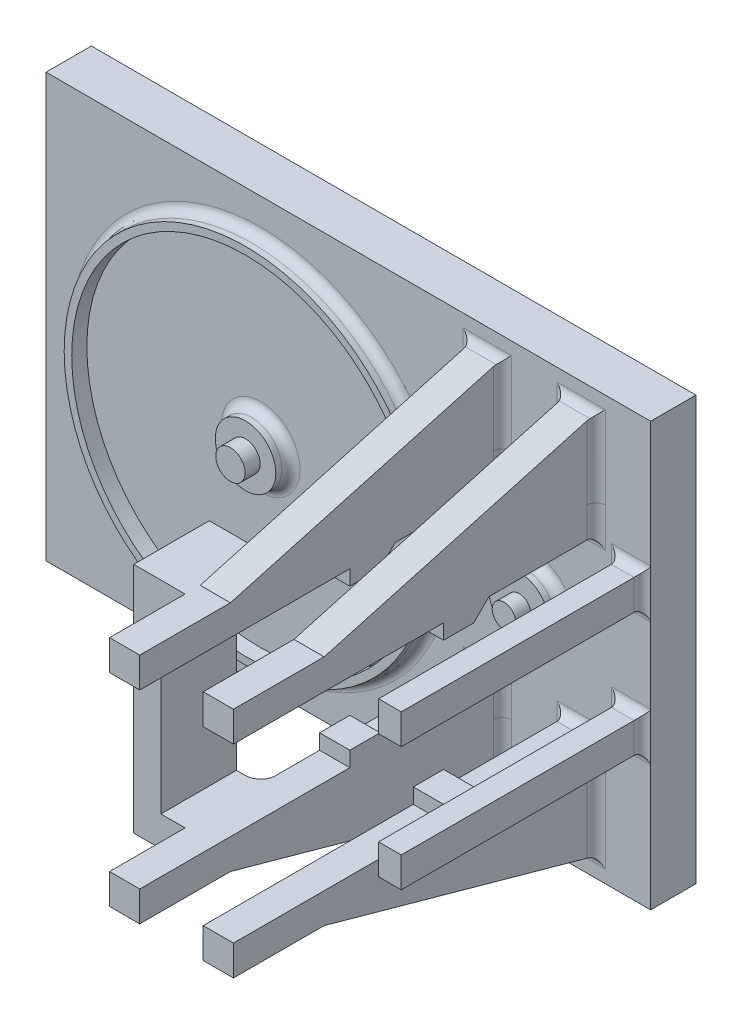
from build123d import *

# Parameters (mm, degrees)
SKETCH3_W            = 200
SKETCH3_H            = 140
BOSS_EXTRUDE1_DEPTH  = 15
SKETCH4_W            = 5
SKETCH4_H            = 10
SKETCH4_W_2          = 10
SKETCH4_H_2          = 5
BOSS_EXTRUDE5_DEPTH  = 70
SKETCH8_W            = 10
SKETCH8_H            = 10
BOSS_EXTRUDE6_DEPTH  = 5
CUT_EXTRUDE2_REACH   = 212.668
SKETCH10_W           = 10
SKETCH10_H           = 10
BOSS_EXTRUDE7_DEPTH  = 5
CUT_EXTRUDE3_REACH   = 212.668
SKETCH12_R           = 10
BOSS_EXTRUDE8_DEPTH  = 5
SKETCH13_R           = 4.85
SKETCH13_R_2         = 3.85
BOSS_EXTRUDE9_DEPTH  = 5
SKETCH14_W           = 5
SKETCH14_H           = 10
CUT_EXTRUDE4_DEPTH   = 20
SKETCH16_W           = 10
SKETCH16_H           = 5
SKETCH16_W_2         = 2.5
SKETCH16_H_2         = 10
BOSS_EXTRUDE11_DEPTH = 70
SKETCH17_W           = 5
SKETCH17_H           = 10
BOSS_EXTRUDE12_DEPTH = 20
FILLET1_R            = 3
SKETCH18_W           = 10
SKETCH18_H           = 10
BOSS_EXTRUDE13_DEPTH = 50
SKETCH19_W           = 10
SKETCH19_H           = 5
BOSS_EXTRUDE14_DEPTH = 5
FILLET3_R            = 3
SKETCH20_W           = 7.5
SKETCH20_H           = 10
SKETCH20_H_2         = 10.000293456
BOSS_EXTRUDE16_DEPTH = 10
BOSS_EXTRUDE17_REACH = 261.083
SKETCH22_W           = 21
SKETCH22_H           = 90
CUT_EXTRUDE6_DEPTH   = 258.239674312
SKETCH23_W           = 21
SKETCH23_H           = 90
CUT_EXTRUDE7_DEPTH   = 258.239674312
FILLET4_R            = 3
BOSS_EXTRUDE19_DEPTH = 50
CUT_EXTRUDE9_DEPTH   = 25
FILLET5_R            = 5
SKETCH28_R           = 13
CUT_EXTRUDE10_DEPTH  = 10
SKETCH29_R           = 10
BOSS_EXTRUDE21_DEPTH = 5
SKETCH30_R           = 3.9
BOSS_EXTRUDE22_DEPTH = 5
FILLET6_R            = 3
SKETCH15_R           = 60
SKETCH15_R_2         = 57.5
BOSS_EXTRUDE23_DEPTH = 5
FILLET7_R            = 3


with BuildPart() as part:
    # Sketch3 → Boss-Extrude1 (new body)
    with BuildSketch(Plane.XY):
        with Locations((100, 70)):
            Rectangle(SKETCH3_W, SKETCH3_H)
    extrude(amount=-BOSS_EXTRUDE1_DEPTH)

    # Sketch4 → Boss-Extrude5 (add)
    with BuildSketch(Plane.XY):
        with Locations((192.5, 49.5)):
            Rectangle(SKETCH4_W, SKETCH4_H)
        with Locations((192.5, 90.5)):
            Rectangle(SKETCH4_W, SKETCH4_H)
        with Locations((177, 101)):
            Rectangle(SKETCH4_W_2, SKETCH4_H_2)
        with Locations((146, 101)):
            Rectangle(SKETCH4_W_2, SKETCH4_H_2)
        with Locations((146, 39)):
            Rectangle(SKETCH4_W_2, SKETCH4_H_2)
        with Locations((177, 39)):
            Rectangle(SKETCH4_W_2, SKETCH4_H_2)
    extrude(amount=BOSS_EXTRUDE5_DEPTH)

    # Sketch8 → Boss-Extrude6 (add)
    with BuildSketch(Plane.XZ.offset(-98.5)):
        with Locations((146, 40.5)):
            Rectangle(SKETCH8_W, SKETCH8_H)
        with Locations((177, 40.5)):
            Rectangle(SKETCH8_W, SKETCH8_H)
    extrude(amount=BOSS_EXTRUDE6_DEPTH)

    # Cut-Extrude2: up to this face of the body (flat: up to its plane)
    cut_extrude2_end = Plane(part.part.faces().sort_by_distance((182, 100.375, 35.6875))[0])
    # Sketch9 → Cut-Extrude2 (cut, up to the picked face)
    with BuildSketch(Plane.ZY.offset(-141), mode=Mode.PRIVATE) as cut_extrude2_sk1:
        Polygon((40.5, 93.5), (35.5, 93.5), (35.5, 98.5), align=None)
    cut_extrude2_tool1 = split(extrude(cut_extrude2_sk1.sketch, amount=-CUT_EXTRUDE2_REACH, mode=Mode.PRIVATE), bisect_by=cut_extrude2_end, keep=Keep.BOTH, mode=Mode.PRIVATE)
    add(cut_extrude2_tool1.solids().sort_by(Axis((141, 95.166667, 37.166667), (1, 0, 0)))[0], mode=Mode.SUBTRACT)

    # Sketch10 → Boss-Extrude7 (add)
    with BuildSketch(Plane(origin=(0, 41.5, 0), x_dir=(1, 0, 0), z_dir=(0, 1, 0))):
        with Locations((146, -40.5)):
            Rectangle(SKETCH10_W, SKETCH10_H)
        with Locations((177, -40.5)):
            Rectangle(SKETCH10_W, SKETCH10_H)
    extrude(amount=BOSS_EXTRUDE7_DEPTH)

    # Cut-Extrude3: up to this face of the body (flat: up to its plane)
    cut_extrude3_end = Plane(part.part.faces().sort_by_distance((182, 39.625, 35.6875))[0])
    # Sketch11 → Cut-Extrude3 (cut, up to the picked face)
    with BuildSketch(Plane.ZY.offset(-141), mode=Mode.PRIVATE) as cut_extrude3_sk1:
        Polygon((35.5, 41.5), (40.5, 46.5), (35.5, 46.5), align=None)
    cut_extrude3_tool1 = split(extrude(cut_extrude3_sk1.sketch, amount=-CUT_EXTRUDE3_REACH, mode=Mode.PRIVATE), bisect_by=cut_extrude3_end, keep=Keep.BOTH, mode=Mode.PRIVATE)
    add(cut_extrude3_tool1.solids().sort_by(Axis((141, 44.833333, 37.166667), (1, 0, 0)))[0], mode=Mode.SUBTRACT)

    # Sketch12 → Boss-Extrude8 (add)
    with BuildSketch(Plane.XY):
        with Locations(Location((161.5, 68.111226305, 0), (0, 0, 180))):
            Circle(SKETCH12_R)
        with Locations(Location((71, 68.111226305, 0), (0, 0, 180))):
            Circle(SKETCH12_R)
    extrude(amount=BOSS_EXTRUDE8_DEPTH)

    # Sketch13 → Boss-Extrude9 (add)
    with BuildSketch(Plane.XY.offset(5)):
        with Locations((71, 68.111226305)):
            Circle(SKETCH13_R)
        with Locations((161.5, 68.111226305)):
            Circle(SKETCH13_R_2)
    extrude(amount=BOSS_EXTRUDE9_DEPTH)

    # Sketch14 → Cut-Extrude4 (cut)
    with BuildSketch(Plane.XY.offset(70)):
        with Locations((192.5, 90.5)):
            Rectangle(SKETCH14_W, SKETCH14_H)
        with Locations((192.5, 49.5)):
            Rectangle(SKETCH14_W, SKETCH14_H)
    extrude(amount=-CUT_EXTRUDE4_DEPTH, mode=Mode.SUBTRACT)

    # Sketch16 → Boss-Extrude11 (add)
    with BuildSketch(Plane.XY):
        with Locations((146, 106)):
            Rectangle(SKETCH16_W, SKETCH16_H)
        with Locations((177, 106)):
            Rectangle(SKETCH16_W, SKETCH16_H)
        with Locations((196.25, 90.5)):
            Rectangle(SKETCH16_W_2, SKETCH16_H_2)
        with Locations((146, 34)):
            Rectangle(SKETCH16_W, SKETCH16_H)
        with Locations((177, 34)):
            Rectangle(SKETCH16_W, SKETCH16_H)
        with Locations((196.25, 49.5)):
            Rectangle(SKETCH16_W_2, SKETCH16_H_2)
    extrude(amount=BOSS_EXTRUDE11_DEPTH)

    # Sketch17 → Boss-Extrude12 (add)
    with BuildSketch(Plane.XY.offset(50)):
        with Locations((192.5, 90.5)):
            Rectangle(SKETCH17_W, SKETCH17_H)
        with Locations((192.5, 49.5)):
            Rectangle(SKETCH17_W, SKETCH17_H)
    extrude(amount=BOSS_EXTRUDE12_DEPTH)

    # Fillet1
    # the kernel refuses this fillet: 3 mm, written as the material it adds along each edge
    with BuildSketch(Plane(origin=(190, 54.5, 0), x_dir=(-1, 0, 0), z_dir=(0, -1, 0)), Plane(origin=(190, 95.5, 0), x_dir=(-1, 0, 0), z_dir=(0, -1, 0)), Plane(origin=(172, 98.5, 0), x_dir=(0, -1, 0), z_dir=(1, 0, 0)), Plane(origin=(141, 98.5, 0), x_dir=(0, -1, 0), z_dir=(1, 0, 0)), Plane(origin=(182, 41.5, 0), x_dir=(0, 1, 0), z_dir=(-1, 0, 0)), Plane(origin=(151, 41.5, 0), x_dir=(0, 1, 0), z_dir=(-1, 0, 0))) as fillet1_piece_1:
        with BuildLine():
            CenterArc((FILLET1_R, -FILLET1_R), FILLET1_R, 90, 90)
            Line((0, -FILLET1_R), (-FILLET1_R * 0.02, -FILLET1_R))
            Line((-FILLET1_R * 0.02, -FILLET1_R), (-FILLET1_R * 0.02, FILLET1_R * 0.02))
            Line((-FILLET1_R * 0.02, FILLET1_R * 0.02), (FILLET1_R, FILLET1_R * 0.02))
            Line((FILLET1_R, FILLET1_R * 0.02), (FILLET1_R, 0))
        make_face()
    extrude(amount=10)
    with BuildSketch(Plane(origin=(141, 98.5, 0), x_dir=(-1, 0, 0), z_dir=(0, 1, 0)), Plane(origin=(151, 108.5, 0), x_dir=(1, 0, 0), z_dir=(0, -1, 0)), Plane(origin=(172, 98.5, 0), x_dir=(-1, 0, 0), z_dir=(0, 1, 0)), Plane(origin=(182, 108.5, 0), x_dir=(1, 0, 0), z_dir=(0, -1, 0)), Plane(origin=(182, 41.5, 0), x_dir=(1, 0, 0), z_dir=(0, -1, 0)), Plane(origin=(172, 31.5, 0), x_dir=(-1, 0, 0), z_dir=(0, 1, 0)), Plane(origin=(151, 41.5, 0), x_dir=(1, 0, 0), z_dir=(0, -1, 0)), Plane(origin=(141, 31.5, 0), x_dir=(-1, 0, 0), z_dir=(0, 1, 0))) as fillet1_piece_2:
        with BuildLine():
            CenterArc((FILLET1_R, FILLET1_R), FILLET1_R, 180, 90)
            Line((0, FILLET1_R), (-FILLET1_R * 0.02, FILLET1_R))
            Line((-FILLET1_R * 0.02, FILLET1_R), (-FILLET1_R * 0.02, -FILLET1_R * 0.02))
            Line((-FILLET1_R * 0.02, -FILLET1_R * 0.02), (FILLET1_R, -FILLET1_R * 0.02))
            Line((FILLET1_R, -FILLET1_R * 0.02), (FILLET1_R, 0))
        make_face()
    extrude(amount=10)
    with BuildSketch(Plane(origin=(190, 95.5, 0), x_dir=(0, 1, 0), z_dir=(1, 0, 0)), Plane(origin=(197.5, 85.5, 0), x_dir=(0, -1, 0), z_dir=(-1, 0, 0)), Plane(origin=(190, 54.5, 0), x_dir=(0, 1, 0), z_dir=(1, 0, 0)), Plane(origin=(197.5, 44.5, 0), x_dir=(0, -1, 0), z_dir=(-1, 0, 0))) as fillet1_piece_3:
        with BuildLine():
            CenterArc((FILLET1_R, FILLET1_R), FILLET1_R, 180, 90)
            Line((0, FILLET1_R), (-FILLET1_R * 0.02, FILLET1_R))
            Line((-FILLET1_R * 0.02, FILLET1_R), (-FILLET1_R * 0.02, -FILLET1_R * 0.02))
            Line((-FILLET1_R * 0.02, -FILLET1_R * 0.02), (FILLET1_R, -FILLET1_R * 0.02))
            Line((FILLET1_R, -FILLET1_R * 0.02), (FILLET1_R, 0))
        make_face()
    extrude(amount=7.5)
    with BuildSketch(Plane(origin=(197.5, 95.5, 0), x_dir=(1, 0, 0), z_dir=(0, -1, 0)), Plane(origin=(197.5, 54.5, 0), x_dir=(1, 0, 0), z_dir=(0, -1, 0))) as fillet1_piece_4:
        with BuildLine():
            CenterArc((3, 2.958039892), FILLET1_R, 180, 80.405931773)
            Line((0, 2.958039892), (-0.06, 2.958039892))
            Line((-0.06, 2.958039892), (-0.06, 0))
            Line((-0.06, 0), (0, -0.06))
            ThreePointArc((0, -0.06), (1.25, -0.06), (2.49, -0.059160798))
            Line((2.49, -0.059160798), (2.5, 0))
        make_face()
    extrude(amount=10)
    with BuildSketch(Plane(origin=(182.5, 54.5, 0), x_dir=(0, 1, 0), z_dir=(1, 0, 0))) as fillet1_piece_5a_section:
        with BuildLine():
            CenterArc((FILLET1_R, FILLET1_R), FILLET1_R, 180, 90)
            Line((0, FILLET1_R), (-FILLET1_R * 0.02, FILLET1_R))
            Line((-FILLET1_R * 0.02, FILLET1_R), (-FILLET1_R * 0.02, -FILLET1_R * 0.02))
            Line((-FILLET1_R * 0.02, -FILLET1_R * 0.02), (FILLET1_R, -FILLET1_R * 0.02))
            Line((FILLET1_R, -FILLET1_R * 0.02), (FILLET1_R, 0))
        make_face()
    fillet1_piece_5a = extrude(amount=15, mode=Mode.PRIVATE)
    fillet1_piece_5a = split(fillet1_piece_5a, bisect_by=Plane(origin=(190, 55.179185343, 0.679185343), z_dir=(-1, 0, 0)), keep=Keep.TOP, mode=Mode.PRIVATE)
    with BuildSketch(Plane(origin=(190, 62, 0), x_dir=(-1, 0, 0), z_dir=(0, -1, 0))) as fillet1_piece_5b_section:
        with BuildLine():
            CenterArc((FILLET1_R, -FILLET1_R), FILLET1_R, 90, 90)
            Line((0, -FILLET1_R), (-FILLET1_R * 0.02, -FILLET1_R))
            Line((-FILLET1_R * 0.02, -FILLET1_R), (-FILLET1_R * 0.02, FILLET1_R * 0.02))
            Line((-FILLET1_R * 0.02, FILLET1_R * 0.02), (FILLET1_R, FILLET1_R * 0.02))
            Line((FILLET1_R, FILLET1_R * 0.02), (FILLET1_R, 0))
        make_face()
    fillet1_piece_5b = extrude(amount=17.5, mode=Mode.PRIVATE)
    fillet1_piece_5b = split(fillet1_piece_5b, bisect_by=Plane(origin=(189.320814657, 54.5, 0.679185343), z_dir=(0, 1, 0)), keep=Keep.TOP, mode=Mode.PRIVATE)
    fillet1_piece_5 = fillet1_piece_5a & fillet1_piece_5b
    add(fillet1_piece_5)
    with BuildSketch(Plane(origin=(197.5, 44.5, 0), x_dir=(0, -1, 0), z_dir=(-1, 0, 0))) as fillet1_piece_6a_section:
        with BuildLine():
            CenterArc((FILLET1_R, FILLET1_R), FILLET1_R, 180, 90)
            Line((0, FILLET1_R), (-FILLET1_R * 0.02, FILLET1_R))
            Line((-FILLET1_R * 0.02, FILLET1_R), (-FILLET1_R * 0.02, -FILLET1_R * 0.02))
            Line((-FILLET1_R * 0.02, -FILLET1_R * 0.02), (FILLET1_R, -FILLET1_R * 0.02))
            Line((FILLET1_R, -FILLET1_R * 0.02), (FILLET1_R, 0))
        make_face()
    fillet1_piece_6a = extrude(amount=15, mode=Mode.PRIVATE)
    fillet1_piece_6a = split(fillet1_piece_6a, bisect_by=Plane(origin=(190, 43.820814657, 0.679185343), z_dir=(-1, 0, 0)), keep=Keep.TOP, mode=Mode.PRIVATE)
    with BuildSketch(Plane(origin=(190, 54.5, 0), x_dir=(-1, 0, 0), z_dir=(0, -1, 0))) as fillet1_piece_6b_section:
        with BuildLine():
            CenterArc((FILLET1_R, -FILLET1_R), FILLET1_R, 90, 90)
            Line((0, -FILLET1_R), (-FILLET1_R * 0.02, -FILLET1_R))
            Line((-FILLET1_R * 0.02, -FILLET1_R), (-FILLET1_R * 0.02, FILLET1_R * 0.02))
            Line((-FILLET1_R * 0.02, FILLET1_R * 0.02), (FILLET1_R, FILLET1_R * 0.02))
            Line((FILLET1_R, FILLET1_R * 0.02), (FILLET1_R, 0))
        make_face()
    fillet1_piece_6b = extrude(amount=17.5, mode=Mode.PRIVATE)
    fillet1_piece_6b = split(fillet1_piece_6b, bisect_by=Plane(origin=(189.320814657, 44.5, 0.679185343), z_dir=(0, -1, 0)), keep=Keep.TOP, mode=Mode.PRIVATE)
    fillet1_piece_6 = fillet1_piece_6a & fillet1_piece_6b
    add(fillet1_piece_6)
    with BuildSketch(Plane(origin=(190, 103, 0), x_dir=(-1, 0, 0), z_dir=(0, -1, 0))) as fillet1_piece_7a_section:
        with BuildLine():
            CenterArc((FILLET1_R, -FILLET1_R), FILLET1_R, 90, 90)
            Line((0, -FILLET1_R), (-FILLET1_R * 0.02, -FILLET1_R))
            Line((-FILLET1_R * 0.02, -FILLET1_R), (-FILLET1_R * 0.02, FILLET1_R * 0.02))
            Line((-FILLET1_R * 0.02, FILLET1_R * 0.02), (FILLET1_R, FILLET1_R * 0.02))
            Line((FILLET1_R, FILLET1_R * 0.02), (FILLET1_R, 0))
        make_face()
    fillet1_piece_7a = extrude(amount=17.5, mode=Mode.PRIVATE)
    fillet1_piece_7a = split(fillet1_piece_7a, bisect_by=Plane(origin=(189.320814657, 95.5, 0.679185343), z_dir=(0, 1, 0)), keep=Keep.TOP, mode=Mode.PRIVATE)
    with BuildSketch(Plane(origin=(182.5, 95.5, 0), x_dir=(0, 1, 0), z_dir=(1, 0, 0))) as fillet1_piece_7b_section:
        with BuildLine():
            CenterArc((FILLET1_R, FILLET1_R), FILLET1_R, 180, 90)
            Line((0, FILLET1_R), (-FILLET1_R * 0.02, FILLET1_R))
            Line((-FILLET1_R * 0.02, FILLET1_R), (-FILLET1_R * 0.02, -FILLET1_R * 0.02))
            Line((-FILLET1_R * 0.02, -FILLET1_R * 0.02), (FILLET1_R, -FILLET1_R * 0.02))
            Line((FILLET1_R, -FILLET1_R * 0.02), (FILLET1_R, 0))
        make_face()
    fillet1_piece_7b = extrude(amount=15, mode=Mode.PRIVATE)
    fillet1_piece_7b = split(fillet1_piece_7b, bisect_by=Plane(origin=(190, 96.179185343, 0.679185343), z_dir=(-1, 0, 0)), keep=Keep.TOP, mode=Mode.PRIVATE)
    fillet1_piece_7 = fillet1_piece_7a & fillet1_piece_7b
    add(fillet1_piece_7)
    with BuildSketch(Plane(origin=(197.5, 85.5, 0), x_dir=(0, -1, 0), z_dir=(-1, 0, 0))) as fillet1_piece_8a_section:
        with BuildLine():
            CenterArc((FILLET1_R, FILLET1_R), FILLET1_R, 180, 90)
            Line((0, FILLET1_R), (-FILLET1_R * 0.02, FILLET1_R))
            Line((-FILLET1_R * 0.02, FILLET1_R), (-FILLET1_R * 0.02, -FILLET1_R * 0.02))
            Line((-FILLET1_R * 0.02, -FILLET1_R * 0.02), (FILLET1_R, -FILLET1_R * 0.02))
            Line((FILLET1_R, -FILLET1_R * 0.02), (FILLET1_R, 0))
        make_face()
    fillet1_piece_8a = extrude(amount=15, mode=Mode.PRIVATE)
    fillet1_piece_8a = split(fillet1_piece_8a, bisect_by=Plane(origin=(190, 84.820814657, 0.679185343), z_dir=(-1, 0, 0)), keep=Keep.TOP, mode=Mode.PRIVATE)
    with BuildSketch(Plane(origin=(190, 95.5, 0), x_dir=(-1, 0, 0), z_dir=(0, -1, 0))) as fillet1_piece_8b_section:
        with BuildLine():
            CenterArc((FILLET1_R, -FILLET1_R), FILLET1_R, 90, 90)
            Line((0, -FILLET1_R), (-FILLET1_R * 0.02, -FILLET1_R))
            Line((-FILLET1_R * 0.02, -FILLET1_R), (-FILLET1_R * 0.02, FILLET1_R * 0.02))
            Line((-FILLET1_R * 0.02, FILLET1_R * 0.02), (FILLET1_R, FILLET1_R * 0.02))
            Line((FILLET1_R, FILLET1_R * 0.02), (FILLET1_R, 0))
        make_face()
    fillet1_piece_8b = extrude(amount=17.5, mode=Mode.PRIVATE)
    fillet1_piece_8b = split(fillet1_piece_8b, bisect_by=Plane(origin=(189.320814657, 85.5, 0.679185343), z_dir=(0, -1, 0)), keep=Keep.TOP, mode=Mode.PRIVATE)
    fillet1_piece_8 = fillet1_piece_8a & fillet1_piece_8b
    add(fillet1_piece_8)
    with BuildSketch(Plane(origin=(164.5, 98.5, 0), x_dir=(0, -1, 0), z_dir=(1, 0, 0))) as fillet1_piece_9a_section:
        with BuildLine():
            CenterArc((FILLET1_R, -FILLET1_R), FILLET1_R, 90, 90)
            Line((0, -FILLET1_R), (-FILLET1_R * 0.02, -FILLET1_R))
            Line((-FILLET1_R * 0.02, -FILLET1_R), (-FILLET1_R * 0.02, FILLET1_R * 0.02))
            Line((-FILLET1_R * 0.02, FILLET1_R * 0.02), (FILLET1_R, FILLET1_R * 0.02))
            Line((FILLET1_R, FILLET1_R * 0.02), (FILLET1_R, 0))
        make_face()
    fillet1_piece_9a = extrude(amount=17.5, mode=Mode.PRIVATE)
    fillet1_piece_9a = split(fillet1_piece_9a, bisect_by=Plane(origin=(172, 97.820814657, 0.679185343), z_dir=(-1, 0, 0)), keep=Keep.TOP, mode=Mode.PRIVATE)
    with BuildSketch(Plane(origin=(172, 91, 0), x_dir=(-1, 0, 0), z_dir=(0, 1, 0))) as fillet1_piece_9b_section:
        with BuildLine():
            CenterArc((FILLET1_R, FILLET1_R), FILLET1_R, 180, 90)
            Line((0, FILLET1_R), (-FILLET1_R * 0.02, FILLET1_R))
            Line((-FILLET1_R * 0.02, FILLET1_R), (-FILLET1_R * 0.02, -FILLET1_R * 0.02))
            Line((-FILLET1_R * 0.02, -FILLET1_R * 0.02), (FILLET1_R, -FILLET1_R * 0.02))
            Line((FILLET1_R, -FILLET1_R * 0.02), (FILLET1_R, 0))
        make_face()
    fillet1_piece_9b = extrude(amount=17.5, mode=Mode.PRIVATE)
    fillet1_piece_9b = split(fillet1_piece_9b, bisect_by=Plane(origin=(171.320814657, 98.5, 0.679185343), z_dir=(0, -1, 0)), keep=Keep.TOP, mode=Mode.PRIVATE)
    fillet1_piece_9 = fillet1_piece_9a & fillet1_piece_9b
    add(fillet1_piece_9)
    with BuildSketch(Plane(origin=(172, 98.5, 0), x_dir=(0, -1, 0), z_dir=(1, 0, 0))) as fillet1_piece_10a_section:
        with BuildLine():
            CenterArc((FILLET1_R, -FILLET1_R), FILLET1_R, 90, 90)
            Line((0, -FILLET1_R), (-FILLET1_R * 0.02, -FILLET1_R))
            Line((-FILLET1_R * 0.02, -FILLET1_R), (-FILLET1_R * 0.02, FILLET1_R * 0.02))
            Line((-FILLET1_R * 0.02, FILLET1_R * 0.02), (FILLET1_R, FILLET1_R * 0.02))
            Line((FILLET1_R, FILLET1_R * 0.02), (FILLET1_R, 0))
        make_face()
    fillet1_piece_10a = extrude(amount=17.5, mode=Mode.PRIVATE)
    fillet1_piece_10a = split(fillet1_piece_10a, bisect_by=Plane(origin=(182, 97.820814657, 0.679185343), z_dir=(1, 0, 0)), keep=Keep.TOP, mode=Mode.PRIVATE)
    with BuildSketch(Plane(origin=(182, 108.5, 0), x_dir=(1, 0, 0), z_dir=(0, -1, 0))) as fillet1_piece_10b_section:
        with BuildLine():
            CenterArc((FILLET1_R, FILLET1_R), FILLET1_R, 180, 90)
            Line((0, FILLET1_R), (-FILLET1_R * 0.02, FILLET1_R))
            Line((-FILLET1_R * 0.02, FILLET1_R), (-FILLET1_R * 0.02, -FILLET1_R * 0.02))
            Line((-FILLET1_R * 0.02, -FILLET1_R * 0.02), (FILLET1_R, -FILLET1_R * 0.02))
            Line((FILLET1_R, -FILLET1_R * 0.02), (FILLET1_R, 0))
        make_face()
    fillet1_piece_10b = extrude(amount=17.5, mode=Mode.PRIVATE)
    fillet1_piece_10b = split(fillet1_piece_10b, bisect_by=Plane(origin=(182.679185343, 98.5, 0.679185343), z_dir=(0, -1, 0)), keep=Keep.TOP, mode=Mode.PRIVATE)
    fillet1_piece_10 = fillet1_piece_10a & fillet1_piece_10b
    add(fillet1_piece_10)
    with BuildSketch(Plane(origin=(133.5, 98.5, 0), x_dir=(0, -1, 0), z_dir=(1, 0, 0))) as fillet1_piece_11a_section:
        with BuildLine():
            CenterArc((FILLET1_R, -FILLET1_R), FILLET1_R, 90, 90)
            Line((0, -FILLET1_R), (-FILLET1_R * 0.02, -FILLET1_R))
            Line((-FILLET1_R * 0.02, -FILLET1_R), (-FILLET1_R * 0.02, FILLET1_R * 0.02))
            Line((-FILLET1_R * 0.02, FILLET1_R * 0.02), (FILLET1_R, FILLET1_R * 0.02))
            Line((FILLET1_R, FILLET1_R * 0.02), (FILLET1_R, 0))
        make_face()
    fillet1_piece_11a = extrude(amount=17.5, mode=Mode.PRIVATE)
    fillet1_piece_11a = split(fillet1_piece_11a, bisect_by=Plane(origin=(141, 97.820814657, 0.679185343), z_dir=(-1, 0, 0)), keep=Keep.TOP, mode=Mode.PRIVATE)
    with BuildSketch(Plane(origin=(141, 91, 0), x_dir=(-1, 0, 0), z_dir=(0, 1, 0))) as fillet1_piece_11b_section:
        with BuildLine():
            CenterArc((FILLET1_R, FILLET1_R), FILLET1_R, 180, 90)
            Line((0, FILLET1_R), (-FILLET1_R * 0.02, FILLET1_R))
            Line((-FILLET1_R * 0.02, FILLET1_R), (-FILLET1_R * 0.02, -FILLET1_R * 0.02))
            Line((-FILLET1_R * 0.02, -FILLET1_R * 0.02), (FILLET1_R, -FILLET1_R * 0.02))
            Line((FILLET1_R, -FILLET1_R * 0.02), (FILLET1_R, 0))
        make_face()
    fillet1_piece_11b = extrude(amount=17.5, mode=Mode.PRIVATE)
    fillet1_piece_11b = split(fillet1_piece_11b, bisect_by=Plane(origin=(140.320814657, 98.5, 0.679185343), z_dir=(0, -1, 0)), keep=Keep.TOP, mode=Mode.PRIVATE)
    fillet1_piece_11 = fillet1_piece_11a & fillet1_piece_11b
    add(fillet1_piece_11)
    with BuildSketch(Plane(origin=(141, 98.5, 0), x_dir=(0, -1, 0), z_dir=(1, 0, 0))) as fillet1_piece_12a_section:
        with BuildLine():
            CenterArc((FILLET1_R, -FILLET1_R), FILLET1_R, 90, 90)
            Line((0, -FILLET1_R), (-FILLET1_R * 0.02, -FILLET1_R))
            Line((-FILLET1_R * 0.02, -FILLET1_R), (-FILLET1_R * 0.02, FILLET1_R * 0.02))
            Line((-FILLET1_R * 0.02, FILLET1_R * 0.02), (FILLET1_R, FILLET1_R * 0.02))
            Line((FILLET1_R, FILLET1_R * 0.02), (FILLET1_R, 0))
        make_face()
    fillet1_piece_12a = extrude(amount=17.5, mode=Mode.PRIVATE)
    fillet1_piece_12a = split(fillet1_piece_12a, bisect_by=Plane(origin=(151, 97.820814657, 0.679185343), z_dir=(1, 0, 0)), keep=Keep.TOP, mode=Mode.PRIVATE)
    with BuildSketch(Plane(origin=(151, 108.5, 0), x_dir=(1, 0, 0), z_dir=(0, -1, 0))) as fillet1_piece_12b_section:
        with BuildLine():
            CenterArc((FILLET1_R, FILLET1_R), FILLET1_R, 180, 90)
            Line((0, FILLET1_R), (-FILLET1_R * 0.02, FILLET1_R))
            Line((-FILLET1_R * 0.02, FILLET1_R), (-FILLET1_R * 0.02, -FILLET1_R * 0.02))
            Line((-FILLET1_R * 0.02, -FILLET1_R * 0.02), (FILLET1_R, -FILLET1_R * 0.02))
            Line((FILLET1_R, -FILLET1_R * 0.02), (FILLET1_R, 0))
        make_face()
    fillet1_piece_12b = extrude(amount=17.5, mode=Mode.PRIVATE)
    fillet1_piece_12b = split(fillet1_piece_12b, bisect_by=Plane(origin=(151.679185343, 98.5, 0.679185343), z_dir=(0, -1, 0)), keep=Keep.TOP, mode=Mode.PRIVATE)
    fillet1_piece_12 = fillet1_piece_12a & fillet1_piece_12b
    add(fillet1_piece_12)
    with BuildSketch(Plane(origin=(182, 49, 0), x_dir=(1, 0, 0), z_dir=(0, -1, 0))) as fillet1_piece_13a_section:
        with BuildLine():
            CenterArc((FILLET1_R, FILLET1_R), FILLET1_R, 180, 90)
            Line((0, FILLET1_R), (-FILLET1_R * 0.02, FILLET1_R))
            Line((-FILLET1_R * 0.02, FILLET1_R), (-FILLET1_R * 0.02, -FILLET1_R * 0.02))
            Line((-FILLET1_R * 0.02, -FILLET1_R * 0.02), (FILLET1_R, -FILLET1_R * 0.02))
            Line((FILLET1_R, -FILLET1_R * 0.02), (FILLET1_R, 0))
        make_face()
    fillet1_piece_13a = extrude(amount=17.5, mode=Mode.PRIVATE)
    fillet1_piece_13a = split(fillet1_piece_13a, bisect_by=Plane(origin=(182.679185343, 41.5, 0.679185343), z_dir=(0, 1, 0)), keep=Keep.TOP, mode=Mode.PRIVATE)
    with BuildSketch(Plane(origin=(189.5, 41.5, 0), x_dir=(0, 1, 0), z_dir=(-1, 0, 0))) as fillet1_piece_13b_section:
        with BuildLine():
            CenterArc((FILLET1_R, -FILLET1_R), FILLET1_R, 90, 90)
            Line((0, -FILLET1_R), (-FILLET1_R * 0.02, -FILLET1_R))
            Line((-FILLET1_R * 0.02, -FILLET1_R), (-FILLET1_R * 0.02, FILLET1_R * 0.02))
            Line((-FILLET1_R * 0.02, FILLET1_R * 0.02), (FILLET1_R, FILLET1_R * 0.02))
            Line((FILLET1_R, FILLET1_R * 0.02), (FILLET1_R, 0))
        make_face()
    fillet1_piece_13b = extrude(amount=17.5, mode=Mode.PRIVATE)
    fillet1_piece_13b = split(fillet1_piece_13b, bisect_by=Plane(origin=(182, 42.179185343, 0.679185343), z_dir=(1, 0, 0)), keep=Keep.TOP, mode=Mode.PRIVATE)
    fillet1_piece_13 = fillet1_piece_13a & fillet1_piece_13b
    add(fillet1_piece_13)
    with BuildSketch(Plane(origin=(172, 31.5, 0), x_dir=(-1, 0, 0), z_dir=(0, 1, 0))) as fillet1_piece_14a_section:
        with BuildLine():
            CenterArc((FILLET1_R, FILLET1_R), FILLET1_R, 180, 90)
            Line((0, FILLET1_R), (-FILLET1_R * 0.02, FILLET1_R))
            Line((-FILLET1_R * 0.02, FILLET1_R), (-FILLET1_R * 0.02, -FILLET1_R * 0.02))
            Line((-FILLET1_R * 0.02, -FILLET1_R * 0.02), (FILLET1_R, -FILLET1_R * 0.02))
            Line((FILLET1_R, -FILLET1_R * 0.02), (FILLET1_R, 0))
        make_face()
    fillet1_piece_14a = extrude(amount=17.5, mode=Mode.PRIVATE)
    fillet1_piece_14a = split(fillet1_piece_14a, bisect_by=Plane(origin=(171.320814657, 41.5, 0.679185343), z_dir=(0, 1, 0)), keep=Keep.TOP, mode=Mode.PRIVATE)
    with BuildSketch(Plane(origin=(182, 41.5, 0), x_dir=(0, 1, 0), z_dir=(-1, 0, 0))) as fillet1_piece_14b_section:
        with BuildLine():
            CenterArc((FILLET1_R, -FILLET1_R), FILLET1_R, 90, 90)
            Line((0, -FILLET1_R), (-FILLET1_R * 0.02, -FILLET1_R))
            Line((-FILLET1_R * 0.02, -FILLET1_R), (-FILLET1_R * 0.02, FILLET1_R * 0.02))
            Line((-FILLET1_R * 0.02, FILLET1_R * 0.02), (FILLET1_R, FILLET1_R * 0.02))
            Line((FILLET1_R, FILLET1_R * 0.02), (FILLET1_R, 0))
        make_face()
    fillet1_piece_14b = extrude(amount=17.5, mode=Mode.PRIVATE)
    fillet1_piece_14b = split(fillet1_piece_14b, bisect_by=Plane(origin=(172, 42.179185343, 0.679185343), z_dir=(-1, 0, 0)), keep=Keep.TOP, mode=Mode.PRIVATE)
    fillet1_piece_14 = fillet1_piece_14a & fillet1_piece_14b
    add(fillet1_piece_14)
    with BuildSketch(Plane(origin=(158.5, 41.5, 0), x_dir=(0, 1, 0), z_dir=(-1, 0, 0))) as fillet1_piece_15a_section:
        with BuildLine():
            CenterArc((FILLET1_R, -FILLET1_R), FILLET1_R, 90, 90)
            Line((0, -FILLET1_R), (-FILLET1_R * 0.02, -FILLET1_R))
            Line((-FILLET1_R * 0.02, -FILLET1_R), (-FILLET1_R * 0.02, FILLET1_R * 0.02))
            Line((-FILLET1_R * 0.02, FILLET1_R * 0.02), (FILLET1_R, FILLET1_R * 0.02))
            Line((FILLET1_R, FILLET1_R * 0.02), (FILLET1_R, 0))
        make_face()
    fillet1_piece_15a = extrude(amount=17.5, mode=Mode.PRIVATE)
    fillet1_piece_15a = split(fillet1_piece_15a, bisect_by=Plane(origin=(151, 42.179185343, 0.679185343), z_dir=(1, 0, 0)), keep=Keep.TOP, mode=Mode.PRIVATE)
    with BuildSketch(Plane(origin=(151, 49, 0), x_dir=(1, 0, 0), z_dir=(0, -1, 0))) as fillet1_piece_15b_section:
        with BuildLine():
            CenterArc((FILLET1_R, FILLET1_R), FILLET1_R, 180, 90)
            Line((0, FILLET1_R), (-FILLET1_R * 0.02, FILLET1_R))
            Line((-FILLET1_R * 0.02, FILLET1_R), (-FILLET1_R * 0.02, -FILLET1_R * 0.02))
            Line((-FILLET1_R * 0.02, -FILLET1_R * 0.02), (FILLET1_R, -FILLET1_R * 0.02))
            Line((FILLET1_R, -FILLET1_R * 0.02), (FILLET1_R, 0))
        make_face()
    fillet1_piece_15b = extrude(amount=17.5, mode=Mode.PRIVATE)
    fillet1_piece_15b = split(fillet1_piece_15b, bisect_by=Plane(origin=(151.679185343, 41.5, 0.679185343), z_dir=(0, 1, 0)), keep=Keep.TOP, mode=Mode.PRIVATE)
    fillet1_piece_15 = fillet1_piece_15a & fillet1_piece_15b
    add(fillet1_piece_15)
    with BuildSketch(Plane(origin=(151, 41.5, 0), x_dir=(0, 1, 0), z_dir=(-1, 0, 0))) as fillet1_piece_16a_section:
        with BuildLine():
            CenterArc((FILLET1_R, -FILLET1_R), FILLET1_R, 90, 90)
            Line((0, -FILLET1_R), (-FILLET1_R * 0.02, -FILLET1_R))
            Line((-FILLET1_R * 0.02, -FILLET1_R), (-FILLET1_R * 0.02, FILLET1_R * 0.02))
            Line((-FILLET1_R * 0.02, FILLET1_R * 0.02), (FILLET1_R, FILLET1_R * 0.02))
            Line((FILLET1_R, FILLET1_R * 0.02), (FILLET1_R, 0))
        make_face()
    fillet1_piece_16a = extrude(amount=17.5, mode=Mode.PRIVATE)
    fillet1_piece_16a = split(fillet1_piece_16a, bisect_by=Plane(origin=(141, 42.179185343, 0.679185343), z_dir=(-1, 0, 0)), keep=Keep.TOP, mode=Mode.PRIVATE)
    with BuildSketch(Plane(origin=(141, 31.5, 0), x_dir=(-1, 0, 0), z_dir=(0, 1, 0))) as fillet1_piece_16b_section:
        with BuildLine():
            CenterArc((FILLET1_R, FILLET1_R), FILLET1_R, 180, 90)
            Line((0, FILLET1_R), (-FILLET1_R * 0.02, FILLET1_R))
            Line((-FILLET1_R * 0.02, FILLET1_R), (-FILLET1_R * 0.02, -FILLET1_R * 0.02))
            Line((-FILLET1_R * 0.02, -FILLET1_R * 0.02), (FILLET1_R, -FILLET1_R * 0.02))
            Line((FILLET1_R, -FILLET1_R * 0.02), (FILLET1_R, 0))
        make_face()
    fillet1_piece_16b = extrude(amount=17.5, mode=Mode.PRIVATE)
    fillet1_piece_16b = split(fillet1_piece_16b, bisect_by=Plane(origin=(140.320814657, 41.5, 0.679185343), z_dir=(0, 1, 0)), keep=Keep.TOP, mode=Mode.PRIVATE)
    fillet1_piece_16 = fillet1_piece_16a & fillet1_piece_16b
    add(fillet1_piece_16)
    with BuildSketch(Plane(origin=(190, 95.5, 0), x_dir=(0, 1, 0), z_dir=(1, 0, 0))) as fillet1_piece_17a_section:
        with BuildLine():
            CenterArc((FILLET1_R, FILLET1_R), FILLET1_R, 180, 90)
            Line((0, FILLET1_R), (-FILLET1_R * 0.02, FILLET1_R))
            Line((-FILLET1_R * 0.02, FILLET1_R), (-FILLET1_R * 0.02, -FILLET1_R * 0.02))
            Line((-FILLET1_R * 0.02, -FILLET1_R * 0.02), (FILLET1_R, -FILLET1_R * 0.02))
            Line((FILLET1_R, -FILLET1_R * 0.02), (FILLET1_R, 0))
        make_face()
    fillet1_piece_17a = extrude(amount=15, mode=Mode.PRIVATE)
    fillet1_piece_17a = split(fillet1_piece_17a, bisect_by=Plane(origin=(200, 96.179185343, 0.679185343), z_dir=(-1, 0, 0)), keep=Keep.TOP, mode=Mode.PRIVATE)
    fillet1_piece_17a = split(fillet1_piece_17a, bisect_by=Plane(origin=(197.5, 96.179185343, 0.679185343), z_dir=(1, 0, 0)), keep=Keep.TOP, mode=Mode.PRIVATE)
    with BuildSketch(Plane(origin=(197.5, 102.895099729, 0), x_dir=(1, 0, 0), z_dir=(0, -1, 0))) as fillet1_piece_17b_section:
        with BuildLine():
            CenterArc((3, 2.958039892), FILLET1_R, 180, 80.405931773)
            Line((0, 2.958039892), (-0.06, 2.958039892))
            Line((-0.06, 2.958039892), (-0.06, 0))
            Line((-0.06, 0), (0, -0.06))
            ThreePointArc((0, -0.06), (1.25, -0.06), (2.49, -0.059160798))
            Line((2.49, -0.059160798), (2.5, 0))
        make_face()
    fillet1_piece_17b = extrude(amount=17.395099729, mode=Mode.PRIVATE)
    fillet1_piece_17b = split(fillet1_piece_17b, bisect_by=Plane(origin=(198.116958935, 95.5, 0.68598203), z_dir=(0, 1, 0)), keep=Keep.TOP, mode=Mode.PRIVATE)
    fillet1_piece_17 = fillet1_piece_17a & fillet1_piece_17b
    add(fillet1_piece_17)
    with BuildSketch(Plane(origin=(205, 85.5, 0), x_dir=(0, -1, 0), z_dir=(-1, 0, 0))) as fillet1_piece_18a_section:
        with BuildLine():
            CenterArc((FILLET1_R, FILLET1_R), FILLET1_R, 180, 90)
            Line((0, FILLET1_R), (-FILLET1_R * 0.02, FILLET1_R))
            Line((-FILLET1_R * 0.02, FILLET1_R), (-FILLET1_R * 0.02, -FILLET1_R * 0.02))
            Line((-FILLET1_R * 0.02, -FILLET1_R * 0.02), (FILLET1_R, -FILLET1_R * 0.02))
            Line((FILLET1_R, -FILLET1_R * 0.02), (FILLET1_R, 0))
        make_face()
    fillet1_piece_18a = extrude(amount=15, mode=Mode.PRIVATE)
    fillet1_piece_18a = split(fillet1_piece_18a, bisect_by=Plane(origin=(200, 84.820814657, 0.679185343), z_dir=(-1, 0, 0)), keep=Keep.TOP, mode=Mode.PRIVATE)
    fillet1_piece_18a = split(fillet1_piece_18a, bisect_by=Plane(origin=(197.5, 84.820814657, 0.679185343), z_dir=(1, 0, 0)), keep=Keep.TOP, mode=Mode.PRIVATE)
    with BuildSketch(Plane(origin=(197.5, 95.5, 0), x_dir=(1, 0, 0), z_dir=(0, -1, 0))) as fillet1_piece_18b_section:
        with BuildLine():
            CenterArc((3, 2.958039892), FILLET1_R, 180, 80.405931773)
            Line((0, 2.958039892), (-0.06, 2.958039892))
            Line((-0.06, 2.958039892), (-0.06, 0))
            Line((-0.06, 0), (0, -0.06))
            ThreePointArc((0, -0.06), (1.25, -0.06), (2.49, -0.059160798))
            Line((2.49, -0.059160798), (2.5, 0))
        make_face()
    fillet1_piece_18b = extrude(amount=17.395099729, mode=Mode.PRIVATE)
    fillet1_piece_18b = split(fillet1_piece_18b, bisect_by=Plane(origin=(198.116958935, 85.5, 0.68598203), z_dir=(0, -1, 0)), keep=Keep.TOP, mode=Mode.PRIVATE)
    fillet1_piece_18 = fillet1_piece_18a & fillet1_piece_18b
    add(fillet1_piece_18)
    with BuildSketch(Plane(origin=(190, 54.5, 0), x_dir=(0, 1, 0), z_dir=(1, 0, 0))) as fillet1_piece_19a_section:
        with BuildLine():
            CenterArc((FILLET1_R, FILLET1_R), FILLET1_R, 180, 90)
            Line((0, FILLET1_R), (-FILLET1_R * 0.02, FILLET1_R))
            Line((-FILLET1_R * 0.02, FILLET1_R), (-FILLET1_R * 0.02, -FILLET1_R * 0.02))
            Line((-FILLET1_R * 0.02, -FILLET1_R * 0.02), (FILLET1_R, -FILLET1_R * 0.02))
            Line((FILLET1_R, -FILLET1_R * 0.02), (FILLET1_R, 0))
        make_face()
    fillet1_piece_19a = extrude(amount=15, mode=Mode.PRIVATE)
    fillet1_piece_19a = split(fillet1_piece_19a, bisect_by=Plane(origin=(200, 55.179185343, 0.679185343), z_dir=(-1, 0, 0)), keep=Keep.TOP, mode=Mode.PRIVATE)
    fillet1_piece_19a = split(fillet1_piece_19a, bisect_by=Plane(origin=(197.5, 55.179185343, 0.679185343), z_dir=(1, 0, 0)), keep=Keep.TOP, mode=Mode.PRIVATE)
    with BuildSketch(Plane(origin=(197.5, 61.895099729, 0), x_dir=(1, 0, 0), z_dir=(0, -1, 0))) as fillet1_piece_19b_section:
        with BuildLine():
            CenterArc((3, 2.958039892), FILLET1_R, 180, 80.405931773)
            Line((0, 2.958039892), (-0.06, 2.958039892))
            Line((-0.06, 2.958039892), (-0.06, 0))
            Line((-0.06, 0), (0, -0.06))
            ThreePointArc((0, -0.06), (1.25, -0.06), (2.49, -0.059160798))
            Line((2.49, -0.059160798), (2.5, 0))
        make_face()
    fillet1_piece_19b = extrude(amount=17.395099729, mode=Mode.PRIVATE)
    fillet1_piece_19b = split(fillet1_piece_19b, bisect_by=Plane(origin=(198.116958935, 54.5, 0.68598203), z_dir=(0, 1, 0)), keep=Keep.TOP, mode=Mode.PRIVATE)
    fillet1_piece_19 = fillet1_piece_19a & fillet1_piece_19b
    add(fillet1_piece_19)
    with BuildSketch(Plane(origin=(197.5, 54.5, 0), x_dir=(1, 0, 0), z_dir=(0, -1, 0))) as fillet1_piece_20a_section:
        with BuildLine():
            CenterArc((3, 2.958039892), FILLET1_R, 180, 80.405931773)
            Line((0, 2.958039892), (-0.06, 2.958039892))
            Line((-0.06, 2.958039892), (-0.06, 0))
            Line((-0.06, 0), (0, -0.06))
            ThreePointArc((0, -0.06), (1.25, -0.06), (2.49, -0.059160798))
            Line((2.49, -0.059160798), (2.5, 0))
        make_face()
    fillet1_piece_20a = extrude(amount=17.395099729, mode=Mode.PRIVATE)
    fillet1_piece_20a = split(fillet1_piece_20a, bisect_by=Plane(origin=(198.116958935, 44.5, 0.68598203), z_dir=(0, -1, 0)), keep=Keep.TOP, mode=Mode.PRIVATE)
    with BuildSketch(Plane(origin=(205, 44.5, 0), x_dir=(0, -1, 0), z_dir=(-1, 0, 0))) as fillet1_piece_20b_section:
        with BuildLine():
            CenterArc((FILLET1_R, FILLET1_R), FILLET1_R, 180, 90)
            Line((0, FILLET1_R), (-FILLET1_R * 0.02, FILLET1_R))
            Line((-FILLET1_R * 0.02, FILLET1_R), (-FILLET1_R * 0.02, -FILLET1_R * 0.02))
            Line((-FILLET1_R * 0.02, -FILLET1_R * 0.02), (FILLET1_R, -FILLET1_R * 0.02))
            Line((FILLET1_R, -FILLET1_R * 0.02), (FILLET1_R, 0))
        make_face()
    fillet1_piece_20b = extrude(amount=15, mode=Mode.PRIVATE)
    fillet1_piece_20b = split(fillet1_piece_20b, bisect_by=Plane(origin=(200, 43.820814657, 0.679185343), z_dir=(-1, 0, 0)), keep=Keep.TOP, mode=Mode.PRIVATE)
    fillet1_piece_20b = split(fillet1_piece_20b, bisect_by=Plane(origin=(197.5, 43.820814657, 0.679185343), z_dir=(1, 0, 0)), keep=Keep.TOP, mode=Mode.PRIVATE)
    fillet1_piece_20 = fillet1_piece_20a & fillet1_piece_20b
    add(fillet1_piece_20)

    # Sketch18 → Boss-Extrude13 (add)
    with BuildSketch(Plane.XY.offset(70)):
        with Locations((146, 103.5)):
            Rectangle(SKETCH18_W, SKETCH18_H)
        with Locations((177, 103.5)):
            Rectangle(SKETCH18_W, SKETCH18_H)
        with Locations((146, 36.5)):
            Rectangle(SKETCH18_W, SKETCH18_H)
        with Locations((177, 36.5)):
            Rectangle(SKETCH18_W, SKETCH18_H)
    extrude(amount=BOSS_EXTRUDE13_DEPTH)

    # Sketch19 → Boss-Extrude14 (add)
    with BuildSketch(Plane.XY.offset(45.5)):
        with Locations((146, 96)):
            Rectangle(SKETCH19_W, SKETCH19_H)
        with Locations((177, 96)):
            Rectangle(SKETCH19_W, SKETCH19_H)
        with Locations((177, 44)):
            Rectangle(SKETCH19_W, SKETCH19_H)
        with Locations((146, 44)):
            Rectangle(SKETCH19_W, SKETCH19_H)
    extrude(amount=BOSS_EXTRUDE14_DEPTH)

    # Fillet3
    fillet3_edges = [part.edges().sort_by_distance(p)[0] for p in [
        (81, 68.111226305, 0),
    ]]
    fillet(fillet3_edges, radius=FILLET3_R)

    # Sketch20 → Boss-Extrude16 (add)
    with BuildSketch(Plane.XY.offset(70)):
        with Locations((193.75, 90.5)):
            Rectangle(SKETCH20_W, SKETCH20_H)
        with Locations((193.75, 49.499853272)):
            Rectangle(SKETCH20_W, SKETCH20_H_2)
    extrude(amount=BOSS_EXTRUDE16_DEPTH)

    # Boss-Extrude17: up to this face of the body (flat: up to its plane)
    boss_extrude17_end = Plane(part.part.faces().sort_by_distance((141, 103.128127113, 60.621027721))[0])
    # Sketch21 → Boss-Extrude17 (add, up to the picked face)
    with BuildSketch(Plane(origin=(182, 0, 0), x_dir=(0, 0, -1), z_dir=(1, 0, 0)), mode=Mode.PRIVATE) as boss_extrude17_sk1:
        Polygon((-90, 31.5), (0, 6.5), (0, 31.5), align=None)
    boss_extrude17_tool1 = split(extrude(boss_extrude17_sk1.sketch, amount=-BOSS_EXTRUDE17_REACH, mode=Mode.PRIVATE), bisect_by=boss_extrude17_end, keep=Keep.BOTH, mode=Mode.PRIVATE)
    # Sketch21 → Boss-Extrude17 (add, up to the picked face)
    with BuildSketch(Plane(origin=(182, 0, 0), x_dir=(0, 0, -1), z_dir=(1, 0, 0)), mode=Mode.PRIVATE) as boss_extrude17_sk2:
        Polygon((-90, 108.5), (0, 133.5), (0, 108.5), align=None)
    boss_extrude17_tool2 = split(extrude(boss_extrude17_sk2.sketch, amount=-BOSS_EXTRUDE17_REACH, mode=Mode.PRIVATE), bisect_by=boss_extrude17_end, keep=Keep.BOTH, mode=Mode.PRIVATE)
    add(boss_extrude17_tool1.solids().sort_by(Axis((182, 23.166667, 30), (-1, 0, 0)))[0])
    add(boss_extrude17_tool2.solids().sort_by(Axis((182, 116.833333, 30), (-1, 0, 0)))[0])

    # Sketch22 → Cut-Extrude6 (cut, through all)
    with BuildSketch(Plane.XZ.offset(-108.5)):
        with Locations((161.5, 45)):
            Rectangle(SKETCH22_W, SKETCH22_H)
    extrude(amount=-CUT_EXTRUDE6_DEPTH, mode=Mode.SUBTRACT)

    # Sketch23 → Cut-Extrude7 (cut, through all)
    with BuildSketch(Plane(origin=(0, 31.5, 0), x_dir=(1, 0, 0), z_dir=(0, 1, 0))):
        with Locations((161.5, -45)):
            Rectangle(SKETCH23_W, SKETCH23_H)
    extrude(amount=-CUT_EXTRUDE7_DEPTH, mode=Mode.SUBTRACT)

    # Fillet4
    fillet4_edges = [part.edges().sort_by_distance(p)[0] for p in [
        (177, 6.5, 0),
        (146, 6.5, 0),
        (172, 19, 0),
        (151, 19, 0),
        (141, 19, 0),
        (141, 121, 0),
        (146, 133.5, 0),
        (151, 121, 0),
        (172, 121, 0),
        (177, 133.5, 0),
        (182, 121, 0),
        (182, 19, 0),
    ]]
    fillet(fillet4_edges, radius=FILLET4_R)

    # Sketch25 → Boss-Extrude19 (add)
    with BuildSketch(Plane.XY.offset(120)):
        Polygon((133, 98.5), (141, 98.5), (141, 108.5), (124, 108.5), (124, 31.5), (141, 31.5), (141, 41.5), (133, 41.5), align=None)
    extrude(amount=-BOSS_EXTRUDE19_DEPTH)

    # Sketch26 → Cut-Extrude9 (cut)
    with BuildSketch(Plane.XY.offset(120)):
        Polygon((141, 108.5), (141, 98.5), (133, 98.5), (133, 41.5), (141, 41.5), (141, 31.5), (124, 31.5), (124, 108.5), align=None)
    extrude(amount=-CUT_EXTRUDE9_DEPTH, mode=Mode.SUBTRACT)

    # Fillet5
    fillet5_edges = [part.edges().sort_by_distance(p)[0] for p in [
        (141, 36.5, 70),
        (141, 103.5, 70),
    ]]
    fillet(fillet5_edges, radius=FILLET5_R)

    # Sketch28 → Cut-Extrude10 (cut)
    with BuildSketch(Plane.XY.offset(10)):
        with Locations((161.5, 68.111226305)):
            Circle(SKETCH28_R)
    extrude(amount=-CUT_EXTRUDE10_DEPTH, mode=Mode.SUBTRACT)

    # Sketch29 → Boss-Extrude21 (add)
    with BuildSketch(Plane.XY):
        with Locations(Location((161.5, 70, 0), (0, 0, 180))):
            Circle(SKETCH29_R)
    extrude(amount=BOSS_EXTRUDE21_DEPTH)

    # Sketch30 → Boss-Extrude22 (add)
    with BuildSketch(Plane.XY.offset(5)):
        with Locations((161.5, 70)):
            Circle(SKETCH30_R)
    extrude(amount=BOSS_EXTRUDE22_DEPTH)

    # Fillet6
    fillet6_edges = [part.edges().sort_by_distance(p)[0] for p in [
        (171.5, 70, 0),
    ]]
    fillet(fillet6_edges, radius=FILLET6_R)

    # Sketch15 → Boss-Extrude23 (add)
    with BuildSketch(Plane.XY):
        with Locations(Location((71, 68.111226305, 0), (0, 0, 180))):
            Circle(SKETCH15_R)
        with Locations((71, 68.111226305)):
            Circle(SKETCH15_R_2, mode=Mode.SUBTRACT)
    extrude(amount=BOSS_EXTRUDE23_DEPTH)

    # Fillet7
    fillet7_edges = [part.edges().sort_by_distance(p)[0] for p in [
        (131, 68.111226305, 0),
    ]]
    fillet(fillet7_edges, radius=FILLET7_R)


solid = part.part
